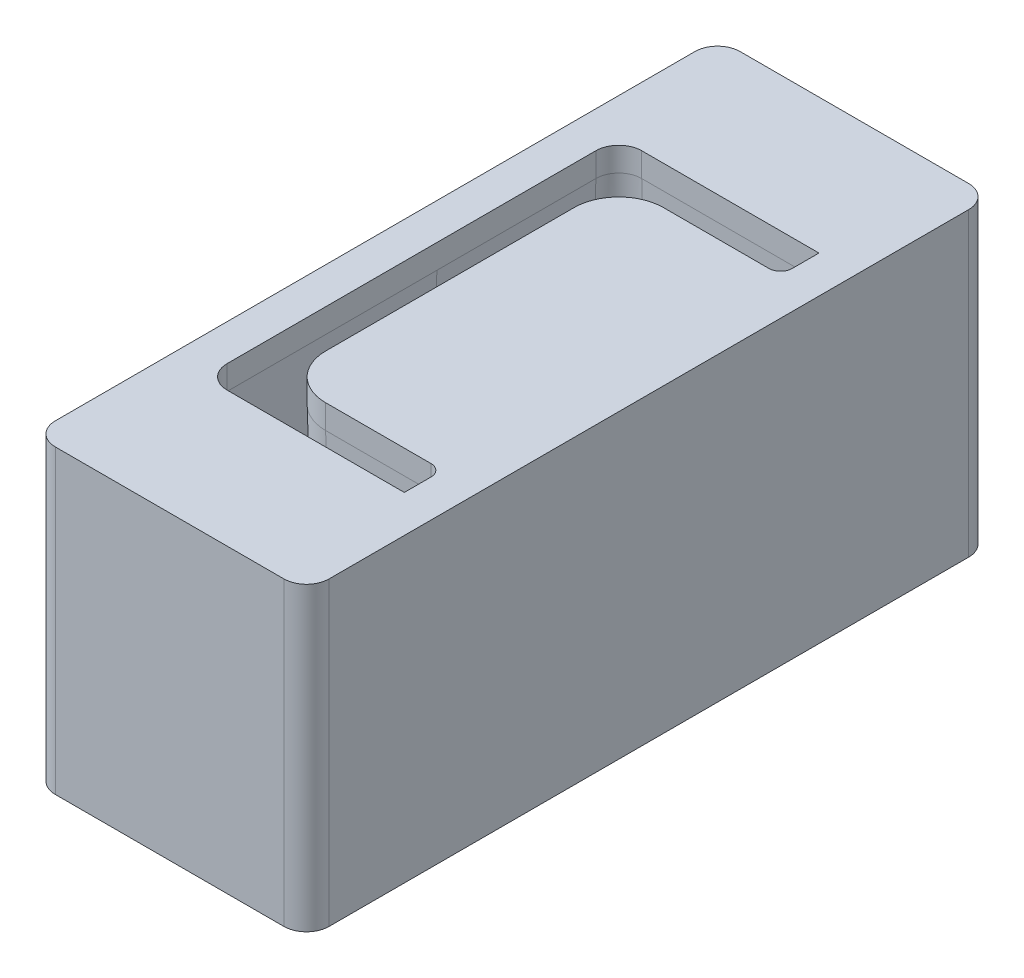
from build123d import *

# Parameters (mm, degrees)
SKETCH1_W             = 36.38
SKETCH1_H             = 91
BOSS_EXTRUDE1_DEPTH   = 40
FILLET1_R             = 3
CUT_EXTRUDE1_REACH    = 73.432
M8_TAPPED_HOLE1_D     = 6.8
M8_TAPPED_HOLE1_DEPTH = 22.25
M8_TAPPED_HOLE1_TIP   = 2.042926105


with BuildPart() as part:
    # Sketch1 → Boss-Extrude1 (new body)
    with BuildSketch(Plane(origin=(0, 0, 0), x_dir=(1, 0, 0), z_dir=(0, 1, 0))):
        with Locations((15.19, -3.37)):
            Rectangle(SKETCH1_W, SKETCH1_H)
    extrude(amount=-BOSS_EXTRUDE1_DEPTH)

    # Fillet1
    fillet1_edges = [part.edges().sort_by_distance(p)[0] for p in [
        (-3, -20, -42.13),
        (33.38, -20, -42.13),
        (33.38, -20, 48.87),
        (-3, -20, 48.87),
    ]]
    fillet(fillet1_edges, radius=FILLET1_R)

    # Sketch2 → Cut-Extrude1 (cut, up to next)
    with BuildSketch(Plane(origin=(0, 0, 0), x_dir=(1, 0, 0), z_dir=(0, 1, 0)), mode=Mode.PRIVATE) as cut_extrude1_sk1:
        with BuildLine():
            Line((28.43, 24.18), (4.88, 24.18))
            ThreePointArc((4.88, 24.18), (2.723324317, 23.286675683), (1.83, 21.13))
            Line((1.83, 21.13), (1.83, -27.87))
            ThreePointArc((1.83, -27.87), (2.723324317, -30.026675683), (4.88, -30.92))
            Line((4.88, -30.92), (28.43, -30.92))
            Line((28.43, -30.92), (28.43, -27.37))
            ThreePointArc((28.43, -27.37), (27.976015511, -26.273984489), (26.88, -25.82))
            Line((26.88, -25.82), (12.88, -25.82))
            ThreePointArc((12.88, -25.82), (8.672714652, -24.077285348), (6.93, -19.87))
            Line((6.93, -19.87), (6.93, 13.13))
            ThreePointArc((6.93, 13.13), (8.672714652, 17.337285348), (12.88, 19.08))
            Line((12.88, 19.08), (26.88, 19.08))
            ThreePointArc((26.88, 19.08), (27.976015511, 19.533984489), (28.43, 20.63))
            Line((28.43, 20.63), (28.43, 24.18))
        make_face()
    cut_extrude1_tool1 = extrude(cut_extrude1_sk1.sketch, amount=-CUT_EXTRUDE1_REACH, mode=Mode.PRIVATE) & part.part
    add(cut_extrude1_tool1.solids().sort_by_distance((6.318153, 0, 3.37))[0], mode=Mode.SUBTRACT)

    # Cut-Sweep1: sweep along a path in Sketch4
    with BuildLine(Plane(origin=(0, 0, 0), x_dir=(1, 0, 0), z_dir=(0, 1, 0))) as cut_sweep1_path:
        Line((28.43, 20.63), (28.43, 24.18))
        Line((28.43, 24.18), (4.88, 24.18))
        ThreePointArc((4.88, 24.18), (2.723324317, 23.286675683), (1.83, 21.13))
        Line((1.83, 21.13), (1.83, -27.87))
        ThreePointArc((1.83, -27.87), (2.723324317, -30.026675683), (4.88, -30.92))
        Line((4.88, -30.92), (28.43, -30.92))
        Line((28.43, -30.92), (28.43, -27.37))
        ThreePointArc((28.43, -27.37), (27.976015511, -26.273984489), (26.88, -25.82))
        Line((26.88, -25.82), (12.88, -25.82))
        ThreePointArc((12.88, -25.82), (8.672714652, -24.077285348), (6.93, -19.87))
        Line((6.93, -19.87), (6.93, 13.13))
        ThreePointArc((6.93, 13.13), (8.672714652, 17.337285348), (12.88, 19.08))
        Line((12.88, 19.08), (26.88, 19.08))
        ThreePointArc((26.88, 19.08), (27.976015511, 19.533984489), (28.43, 20.63))
    # Sketch3 → Cut-Sweep1 (sweep, cut)
    with BuildSketch(Plane.XY):
        Polygon((1.83, -3.2), (1.187653611, -40), (1.83, -40), align=None)
    sweep(path=cut_sweep1_path.line, transition=Transition.RIGHT, mode=Mode.SUBTRACT)

    # M8 Tapped Hole1
    with Locations(Plane(origin=(0, -40, 0), x_dir=(-1, 0, 0), z_dir=(0, -1, 0))):
        with Locations((-15.19, 33.476173195), (-15.19, -40.216173195)):
            Hole(M8_TAPPED_HOLE1_D / 2, depth=M8_TAPPED_HOLE1_DEPTH)
            with Locations((0, 0, -(M8_TAPPED_HOLE1_DEPTH + M8_TAPPED_HOLE1_TIP / 2))):  # 118° drill point
                Cone(0, M8_TAPPED_HOLE1_D / 2, M8_TAPPED_HOLE1_TIP, mode=Mode.SUBTRACT)


solid = part.part
